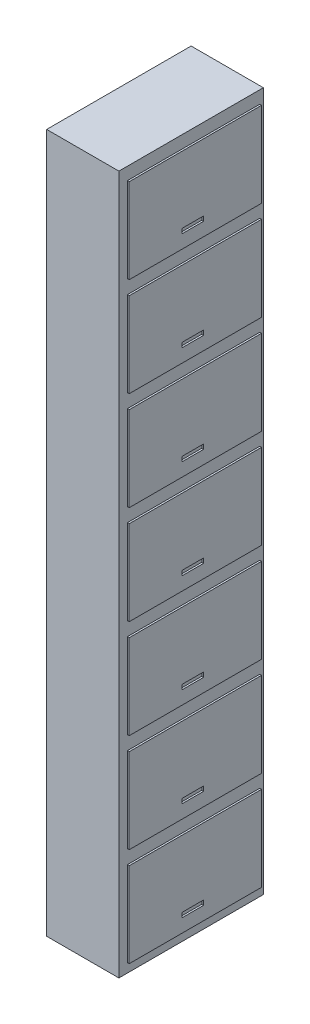
from build123d import *

# Parameters (mm, degrees)
SKETCH1_W           = 400
SKETCH1_H           = 3870
BOSS_EXTRUDE1_DEPTH = 800
SKETCH3_W           = 732.835133331
SKETCH3_H           = 470
SKETCH3_W_2         = 121.072841775
SKETCH3_H_2         = 25.802408902
SKETCH3_H_3         = 25.802408903
BOSS_EXTRUDE3_DEPTH = 10


with BuildPart() as part:
    # Sketch1 → Boss-Extrude1 (new body)
    with BuildSketch(Plane.XY):
        with Locations((63.061970043, 2244.986327315)):
            Rectangle(SKETCH1_W, SKETCH1_H)
    extrude(amount=BOSS_EXTRUDE1_DEPTH)

    # Sketch3 → Boss-Extrude3 (add)
    # profile 1 of 7: a face of its own
    with BuildSketch(Plane(origin=(263.061970043, 0, 0), x_dir=(0, 0, -1), z_dir=(1, 0, 0))):
        with Locations((-386.417566666, 594.986327315)):
            Rectangle(SKETCH3_W, SKETCH3_H)
        with Locations((-401.128332344, 446.85045415)):
            Rectangle(SKETCH3_W_2, SKETCH3_H_2, mode=Mode.SUBTRACT)
    # profile 2 of 7: a face of its own
    with BuildSketch(Plane(origin=(263.061970043, 0, 0), x_dir=(0, 0, -1), z_dir=(1, 0, 0))):
        with Locations((-386.417566666, 1141.758813467)):
            Rectangle(SKETCH3_W, SKETCH3_H)
        with Locations((-401.128332344, 993.622940303)):
            Rectangle(SKETCH3_W_2, SKETCH3_H_3, mode=Mode.SUBTRACT)
    # profile 3 of 7: a face of its own
    with BuildSketch(Plane(origin=(263.061970043, 0, 0), x_dir=(0, 0, -1), z_dir=(1, 0, 0))):
        with Locations((-386.417566666, 1688.531299619)):
            Rectangle(SKETCH3_W, SKETCH3_H)
        with Locations((-401.128332344, 1540.395426455)):
            Rectangle(SKETCH3_W_2, SKETCH3_H_3, mode=Mode.SUBTRACT)
    # profile 4 of 7: a face of its own
    with BuildSketch(Plane(origin=(263.061970043, 0, 0), x_dir=(0, 0, -1), z_dir=(1, 0, 0))):
        with Locations((-386.417566666, 2235.303785772)):
            Rectangle(SKETCH3_W, SKETCH3_H)
        with Locations((-401.128332344, 2087.167912607)):
            Rectangle(SKETCH3_W_2, SKETCH3_H_3, mode=Mode.SUBTRACT)
    # profile 5 of 7: a face of its own
    with BuildSketch(Plane(origin=(263.061970043, 0, 0), x_dir=(0, 0, -1), z_dir=(1, 0, 0))):
        with Locations((-386.417566666, 2782.076271924)):
            Rectangle(SKETCH3_W, SKETCH3_H)
        with Locations((-401.128332344, 2633.940398759)):
            Rectangle(SKETCH3_W_2, SKETCH3_H_3, mode=Mode.SUBTRACT)
    # profile 6 of 7: a face of its own
    with BuildSketch(Plane(origin=(263.061970043, 0, 0), x_dir=(0, 0, -1), z_dir=(1, 0, 0))):
        with Locations((-386.417566666, 3328.848758076)):
            Rectangle(SKETCH3_W, SKETCH3_H)
        with Locations((-401.128332344, 3180.712884911)):
            Rectangle(SKETCH3_W_2, SKETCH3_H_2, mode=Mode.SUBTRACT)
    # profile 7 of 7: a face of its own
    with BuildSketch(Plane(origin=(263.061970043, 0, 0), x_dir=(0, 0, -1), z_dir=(1, 0, 0))):
        with Locations((-386.417566666, 3875.621244228)):
            Rectangle(SKETCH3_W, SKETCH3_H)
        with Locations((-401.128332344, 3727.485371064)):
            Rectangle(SKETCH3_W_2, SKETCH3_H_3, mode=Mode.SUBTRACT)
    extrude(amount=BOSS_EXTRUDE3_DEPTH)


solid = part.part
